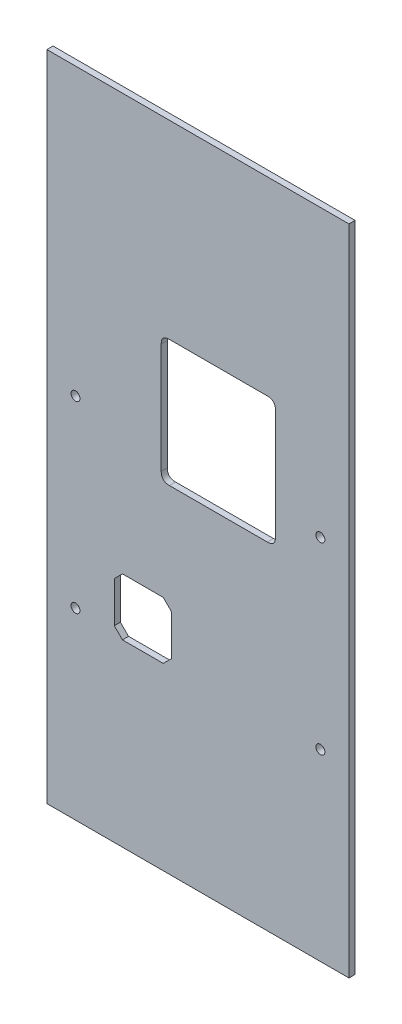
from build123d import *

# Parameters (mm, degrees)
ESQUISSE1_W             = 148
ESQUISSE1_H             = 330
BOSS_EXTRU_1_DEPTH      = 3
ENL_V_MAT_EXTRU_2_REACH = 182.859
ESQUISSE3_R             = 2.2
ENL_V_MAT_EXTRU_3_REACH = 182.859
ESQUISSE4_W             = 148
ESQUISSE4_H             = 10
ENL_V_MAT_EXTRU_4_REACH = 182.859
CONG_1_SIZE             = 4
ENL_V_MAT_EXTRU_5_REACH = 182.859


with BuildPart() as part:
    # Esquisse1 → Boss.-Extru.1 (new body)
    with BuildSketch(Plane.XY):
        Rectangle(ESQUISSE1_W, ESQUISSE1_H)
    extrude(amount=BOSS_EXTRU_1_DEPTH)

    # Esquisse3 → Enlèv. mat.-Extru.2 (cut, up to next)
    with BuildSketch(Plane.XY.offset(3), mode=Mode.PRIVATE) as enl_v_mat_extru_2_sk1:
        with Locations((60, -75)):
            Circle(ESQUISSE3_R)
    enl_v_mat_extru_2_tool1 = extrude(enl_v_mat_extru_2_sk1.sketch, amount=-ENL_V_MAT_EXTRU_2_REACH, mode=Mode.PRIVATE) & part.part
    # Esquisse3 → Enlèv. mat.-Extru.2 (cut, up to next)
    with BuildSketch(Plane.XY.offset(3), mode=Mode.PRIVATE) as enl_v_mat_extru_2_sk2:
        with Locations((60, 15)):
            Circle(ESQUISSE3_R)
    enl_v_mat_extru_2_tool2 = extrude(enl_v_mat_extru_2_sk2.sketch, amount=-ENL_V_MAT_EXTRU_2_REACH, mode=Mode.PRIVATE) & part.part
    enl_v_mat_extru_2_1 = enl_v_mat_extru_2_tool1.solids().sort_by_distance((60, -75, 3))[0]
    add(enl_v_mat_extru_2_1, mode=Mode.SUBTRACT)
    enl_v_mat_extru_2_2 = enl_v_mat_extru_2_tool2.solids().sort_by_distance((60, 15, 3))[0]
    add(enl_v_mat_extru_2_2, mode=Mode.SUBTRACT)
    enl_v_mat_extru_2 = enl_v_mat_extru_2_1 + enl_v_mat_extru_2_2  # Enlèv. mat.-Extru.2 as one shape, for the pattern or mirror that repeats it

    # Esquisse4 → Enlèv. mat.-Extru.3 (cut, up to next)
    with BuildSketch(Plane.XY.offset(3), mode=Mode.PRIVATE) as enl_v_mat_extru_3_sk1:
        with Locations((0, 160)):
            Rectangle(ESQUISSE4_W, ESQUISSE4_H)
    enl_v_mat_extru_3_tool1 = extrude(enl_v_mat_extru_3_sk1.sketch, amount=-ENL_V_MAT_EXTRU_3_REACH, mode=Mode.PRIVATE) & part.part
    add(enl_v_mat_extru_3_tool1.solids().sort_by_distance((0, 160, 3))[0], mode=Mode.SUBTRACT)

    # Esquisse5 → Enlèv. mat.-Extru.4 (cut, up to next)
    with BuildSketch(Plane.XY.offset(3), mode=Mode.PRIVATE) as enl_v_mat_extru_4_sk1:
        Polygon((0, 0), (38, 0), (38, 62), (-18, 62), (-18, 0), align=None)
    enl_v_mat_extru_4_tool1 = extrude(enl_v_mat_extru_4_sk1.sketch, amount=-ENL_V_MAT_EXTRU_4_REACH, mode=Mode.PRIVATE) & part.part
    add(enl_v_mat_extru_4_tool1.solids().sort_by_distance((10, 31, 3))[0], mode=Mode.SUBTRACT)

    # Congé1
    # a fillet whose section is not a circle: 4 mm, written as the material it adds along each edge
    with BuildSketch(Plane(origin=(38, 62, 3), x_dir=(-1, 0, 0), z_dir=(0, 0, -1)), Plane(origin=(-18, 62, 3), x_dir=(0, -1, 0), z_dir=(0, 0, -1)), Plane(origin=(38, 0, 3), x_dir=(0, 1, 0), z_dir=(0, 0, -1))) as cong_1_piece_1:
        with BuildLine():
            Bezier((CONG_1_SIZE, 0), (0, 0), (0, -CONG_1_SIZE), weights=[1, 1, 1])
            Line((0, -CONG_1_SIZE), (0, 0))
            Line((0, 0), (CONG_1_SIZE, 0))
        make_face()
    extrude(amount=3)
    with BuildSketch(Plane(origin=(-18, 0, 3), x_dir=(0, 1, 0), z_dir=(0, 0, -1))) as cong_1_piece_2:
        with BuildLine():
            Bezier((CONG_1_SIZE, 0), (0, 0), (0, CONG_1_SIZE), weights=[1, 1, 1])
            Line((0, CONG_1_SIZE), (0, 0))
            Line((0, 0), (CONG_1_SIZE, 0))
        make_face()
    extrude(amount=3)

    # Esquisse6 → Enlèv. mat.-Extru.5 (cut, up to next)
    with BuildSketch(Plane(origin=(0, 0, 0), x_dir=(-1, 0, 0), z_dir=(0, 0, -1)), mode=Mode.PRIVATE) as enl_v_mat_extru_5_sk1:
        Polygon((17, -49), (37, -49), (41, -53), (41, -73), (37, -77), (17, -77), (13, -73), (13, -53), align=None)
    enl_v_mat_extru_5_tool1 = extrude(enl_v_mat_extru_5_sk1.sketch, amount=-ENL_V_MAT_EXTRU_5_REACH, mode=Mode.PRIVATE) & part.part
    add(enl_v_mat_extru_5_tool1.solids().sort_by_distance((-27, -63, 0))[0], mode=Mode.SUBTRACT)

    # Symétrie1: Enlèv. mat.-Extru.2 across plane
    add(enl_v_mat_extru_2.mirror(Plane(origin=(0, 0, 0), x_dir=(0, 0, 1), z_dir=(1, 0, 0))), mode=Mode.SUBTRACT)


solid = part.part
